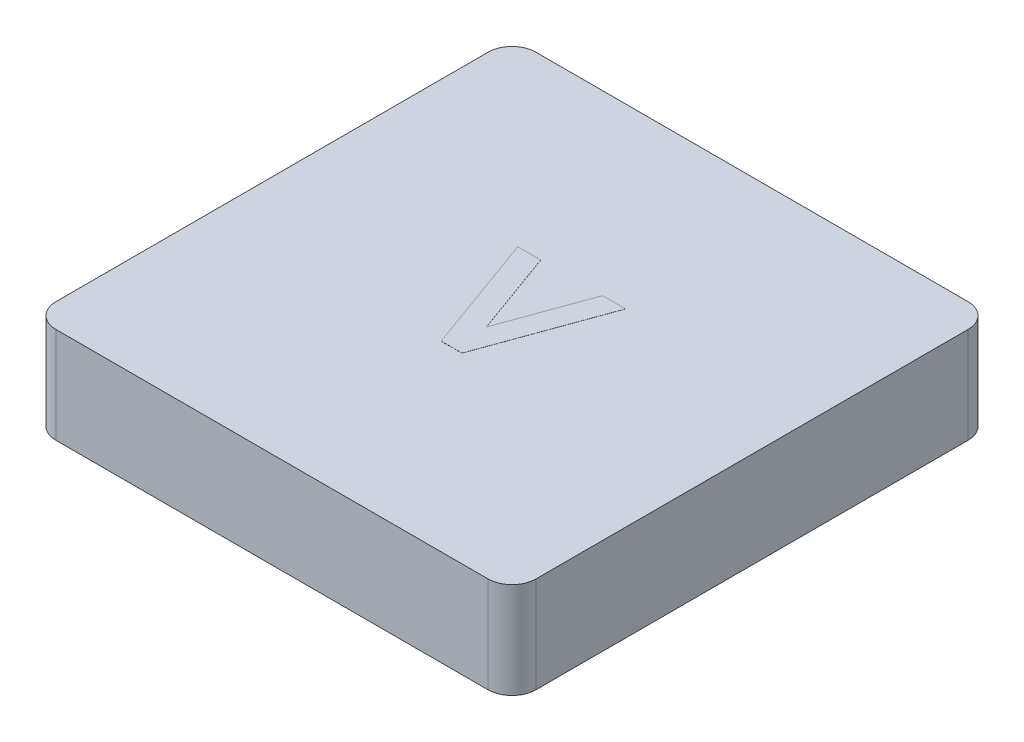
from build123d import *

# Parameters (mm, degrees)
SKETCH1_W           = 12.7
SKETCH1_H           = 12.7
BOSS_EXTRUDE1_DEPTH = 2.54
FILLET1_R           = 0.635
SHELL1_START        = 0.635
SHELL1_OUTLINE_W    = 1.905
SHELL1_OUTLINE_H    = 11.43
SHELL1_DEPTH        = 11.43
SKETCH2_R           = 2.54
BOSS_EXTRUDE2_DEPTH = 1.905
BOSS_EXTRUDE3_DEPTH = 0.00254


# Read off the part's stored shape, not the designer's step: Shell1
with BuildPart() as part:
    # Sketch1 → Boss-Extrude1 (new body)
    with BuildSketch(Plane(origin=(0, 0, 0), x_dir=(1, 0, 0), z_dir=(0, 1, 0))):
        with Locations((6.35, 6.35)):
            Rectangle(SKETCH1_W, SKETCH1_H)
    extrude(amount=BOSS_EXTRUDE1_DEPTH)

    # Fillet1
    fillet1_edges = [part.edges().sort_by_distance(p)[0] for p in [
        (0, 1.27, -12.7),
        (12.7, 1.27, -12.7),
        (12.7, 1.27, 0),
        (0, 1.27, 0),
    ]]
    fillet(fillet1_edges, radius=FILLET1_R)

    # Shell1 outline → Shell1 (cut)
    with BuildSketch(Plane.YZ.offset(SHELL1_START)):
        with Locations((0.9525, -6.35)):
            Rectangle(SHELL1_OUTLINE_W, SHELL1_OUTLINE_H)
    extrude(amount=SHELL1_DEPTH, mode=Mode.SUBTRACT)

    # Sketch2 → Boss-Extrude2 (add)
    with BuildSketch(Plane(origin=(0, 1.905, 0), x_dir=(-1, 0, 0), z_dir=(0, -1, 0))):
        with Locations(Location((-6.35, 6.35, 0), (0, 0, 270))):
            Circle(SKETCH2_R)
    extrude(amount=BOSS_EXTRUDE2_DEPTH)

    # Sketch3 → Boss-Extrude3 (add)
    with BuildSketch(Plane(origin=(0, 2.54, 0), x_dir=(1, 0, 0), z_dir=(0, 1, 0))):
        Polygon((4.851562821, 8.001), (5.460231691, 8.001), (6.276242308, 5.74568149), (7.094160978, 8.001), (7.700921795, 8.001), (6.549729888, 4.826), (6.000846675, 4.826), align=None)
    extrude(amount=BOSS_EXTRUDE3_DEPTH)


solid = part.part
